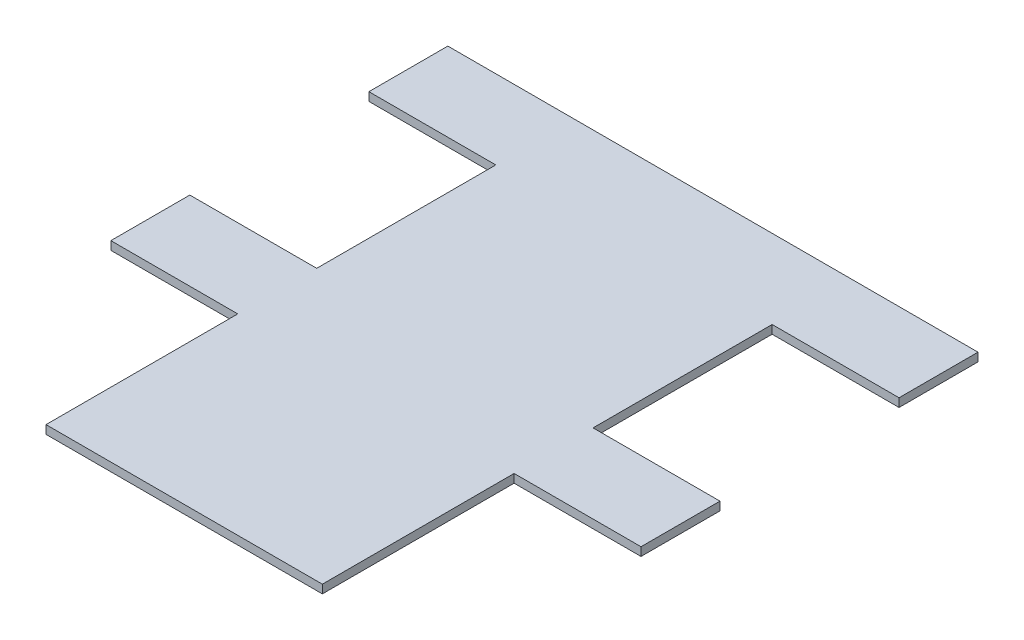
from build123d import *

# Parameters (mm, degrees)
BOSS_EXTRUDE1_DEPTH = 1.5


with BuildPart() as part:
    # Sketch2 → Boss-Extrude1 (new body)
    with BuildSketch(Plane(origin=(0, 0, 0), x_dir=(1, 0, 0), z_dir=(0, 1, 0))):
        Polygon((-22.5, 93.75), (-22.5, 79.75), (0, 79.75), (0, 48), (-22.5, 48), (-22.5, 34), (0, 34), (0, 0), (49, 0), (49, 34), (71.5, 34), (71.5, 48), (49, 48), (49, 79.75), (71.5, 79.75), (71.5, 93.75), align=None)
    extrude(amount=BOSS_EXTRUDE1_DEPTH)


solid = part.part
